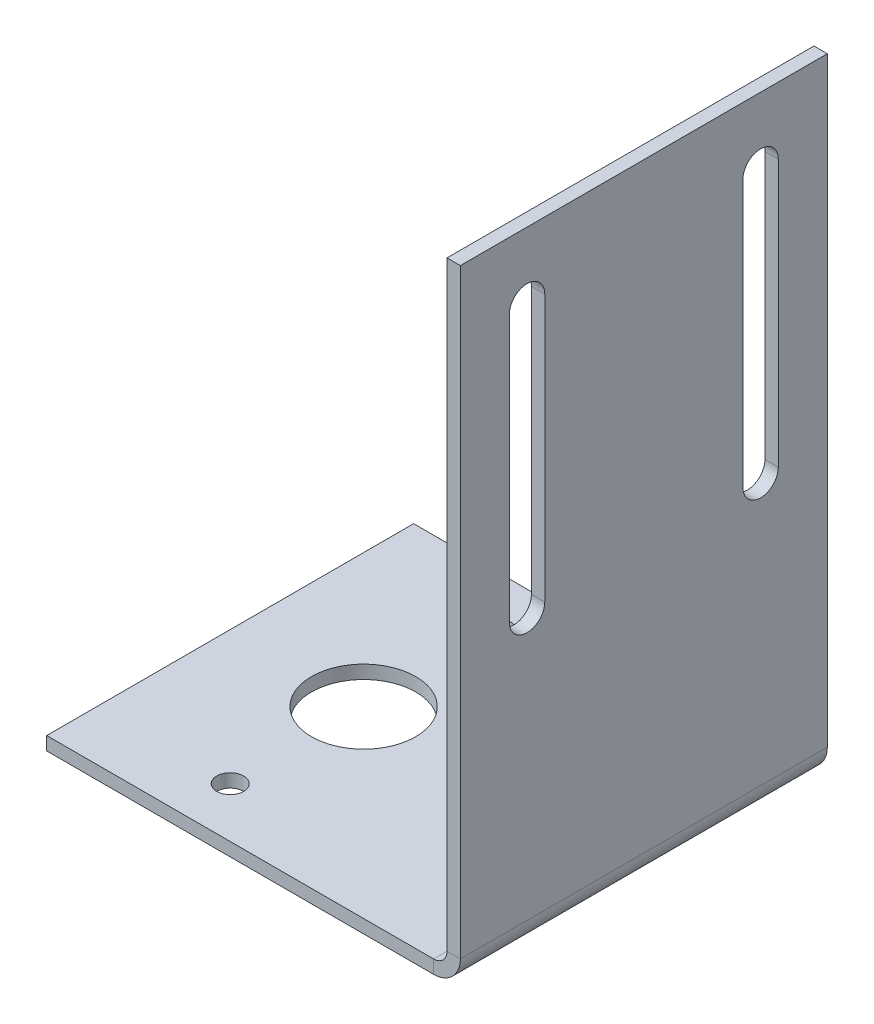
from build123d import *

# Parameters (mm, degrees)
BOSS_EXTRUDE2_DEPTH                  = 69.85
F_10_CLEARANCE_HOLE1_D               = 5.1054
CUT_EXTRUDE1_DEPTH                   = 158.914682345
F_25_32_0_78125_DIAMETER_HOLE1_D     = 19.84375
F_25_32_0_78125_DIAMETER_HOLE1_DEPTH = 9.278336046
F_25_32_0_78125_DIAMETER_HOLE1_TIP   = 5.961663954
CONVERT_SOLID1_START                 = -69.85
CONVERT_SOLID1_DEPTH                 = 69.85
CONVERT_SOLID1_2_DEPTH               = 69.85


# Read off the part's stored shape, not the designer's step: Convert-Solid1
with BuildPart() as part:
    # Sketch8 → Boss-Extrude2 (new body)
    with BuildSketch(Plane.XY):
        Polygon((0, 2.54), (0, 0), (78.74, 0), (78.74, 119.38), (76.2, 119.38), (76.2, 2.54), align=None)
    extrude(amount=-BOSS_EXTRUDE2_DEPTH)

    # #10 Clearance Hole1 (through all)
    with Locations(Plane(origin=(0, 2.54, 0), x_dir=(1, 0, 0), z_dir=(0, 1, 0))):
        with Locations((25.4, 9.525), (25.4, 60.325)):
            Hole(F_10_CLEARANCE_HOLE1_D / 2)

    # E → Cut-Extrude1 (cut, through all)
    with BuildSketch(Plane.ZY.offset(-76.2)):
        with BuildLine():
            Line((-53.7845, 106.68), (-53.7845, 55.88))
            ThreePointArc((-53.7845, 55.88), (-57.15, 52.5145), (-60.5155, 55.88))
            Line((-60.5155, 55.88), (-60.5155, 106.68))
            ThreePointArc((-60.5155, 106.68), (-57.15, 110.0455), (-53.7845, 106.68))
        make_face()
        with BuildLine():
            Line((-9.3345, 106.68), (-9.3345, 55.88))
            ThreePointArc((-9.3345, 55.88), (-12.7, 52.5145), (-16.0655, 55.88))
            Line((-16.0655, 55.88), (-16.0655, 106.68))
            ThreePointArc((-16.0655, 106.68), (-12.7, 110.0455), (-9.3345, 106.68))
        make_face()
    extrude(amount=-CUT_EXTRUDE1_DEPTH, mode=Mode.SUBTRACT)

    # 25/32 (0.78125) Diameter Hole1
    with Locations(Plane(origin=(0, 2.54, 0), x_dir=(1, 0, 0), z_dir=(0, 1, 0))):
        with Locations((25.4, 34.925)):
            Hole(F_25_32_0_78125_DIAMETER_HOLE1_D / 2, depth=F_25_32_0_78125_DIAMETER_HOLE1_DEPTH)
            with Locations((0, 0, -(F_25_32_0_78125_DIAMETER_HOLE1_DEPTH + F_25_32_0_78125_DIAMETER_HOLE1_TIP / 2))):  # 118° drill point
                Cone(0, F_25_32_0_78125_DIAMETER_HOLE1_D / 2, F_25_32_0_78125_DIAMETER_HOLE1_TIP, mode=Mode.SUBTRACT)

    # Convert-Solid1 outline → Convert-Solid1 (cut)
    with BuildSketch(Plane.XY.offset(CONVERT_SOLID1_START)):
        with BuildLine():
            ThreePointArc((78.74, 5.08), (77.252102448, 1.487897552), (73.66, 0))
            Line((73.66, 0), (78.74, 0))
            Line((78.74, 0), (78.74, 5.08))
        make_face()
    extrude(amount=CONVERT_SOLID1_DEPTH, mode=Mode.SUBTRACT)

    # Convert-Solid1 2 outline → Convert-Solid1 2 (add)
    with BuildSketch(Plane.XY.offset(CONVERT_SOLID1_START)):
        with BuildLine():
            ThreePointArc((76.2, 5.08), (75.456051224, 3.283948776), (73.66, 2.54))
            Line((73.66, 2.54), (76.2, 2.54))
            Line((76.2, 2.54), (76.2, 5.08))
        make_face()
    extrude(amount=CONVERT_SOLID1_2_DEPTH)


solid = part.part
